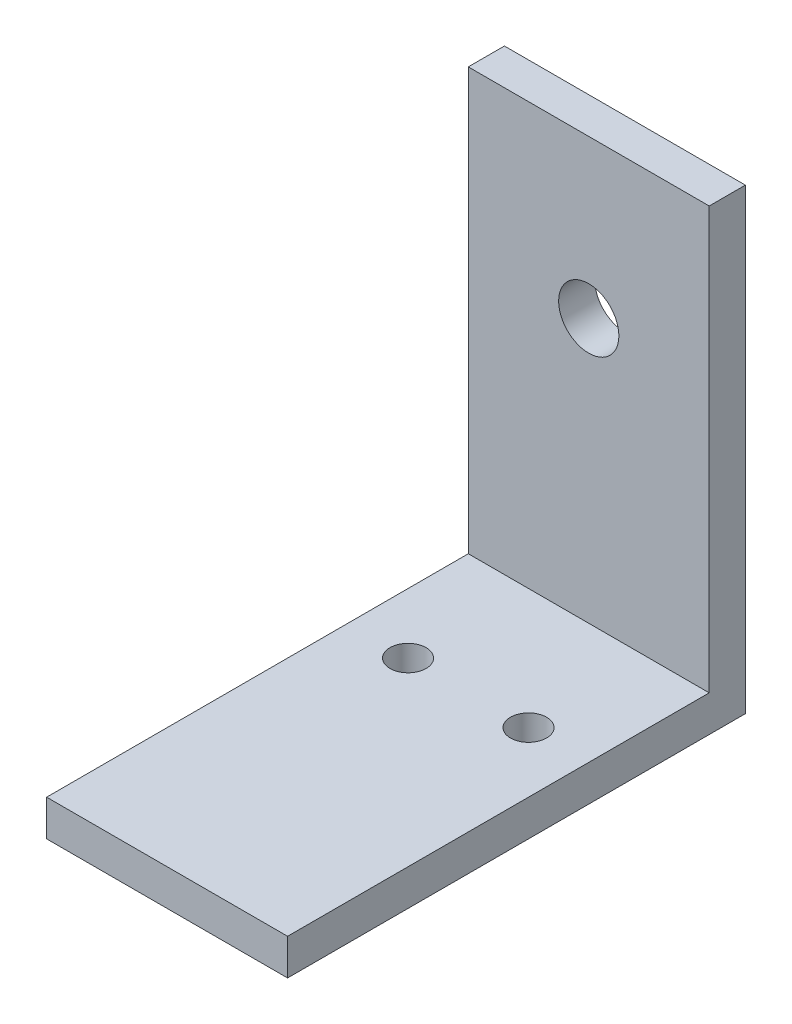
from build123d import *

# Parameters (mm, degrees)
SKETCH_1_W          = 20
SKETCH_1_H          = 38
EXTRUDE_1_DEPTH     = 3
SKETCH_2_W          = 20
SKETCH_2_H          = 3
EXTRUDE_2_DEPTH     = 35
SKETCH_3_R          = 2.5
CUT_EXTRUDE_1_DEPTH = 10
SKETCH_4_R          = 1.5
CUT_EXTRUDE_2_DEPTH = 10


with BuildPart() as part:
    # 草图1 → 凸台-拉伸1 (new body)
    with BuildSketch(Plane.XY):
        Rectangle(SKETCH_1_W, SKETCH_1_H)
    extrude(amount=EXTRUDE_1_DEPTH)

    # 草图2 → 凸台-拉伸2 (add)
    with BuildSketch(Plane.XY.offset(3)):
        with Locations((0, -17.5)):
            Rectangle(SKETCH_2_W, SKETCH_2_H)
    extrude(amount=EXTRUDE_2_DEPTH)

    # 草图3 → 切除-拉伸1 (cut)
    with BuildSketch(Plane(origin=(0, 0, 0), x_dir=(-1, 0, 0), z_dir=(0, 0, -1))):
        with Locations((0, 5.915992135)):
            Circle(SKETCH_3_R)
    extrude(amount=-CUT_EXTRUDE_1_DEPTH, mode=Mode.SUBTRACT)

    # 草图4 → 切除-拉伸2 (cut)
    with BuildSketch(Plane(origin=(0, -16, 0), x_dir=(1, 0, 0), z_dir=(0, 1, 0))):
        with Locations((-5, -13)):
            Circle(SKETCH_4_R)
        with Locations((5, -13)):
            Circle(SKETCH_4_R)
    extrude(amount=-CUT_EXTRUDE_2_DEPTH, mode=Mode.SUBTRACT)


solid = part.part
